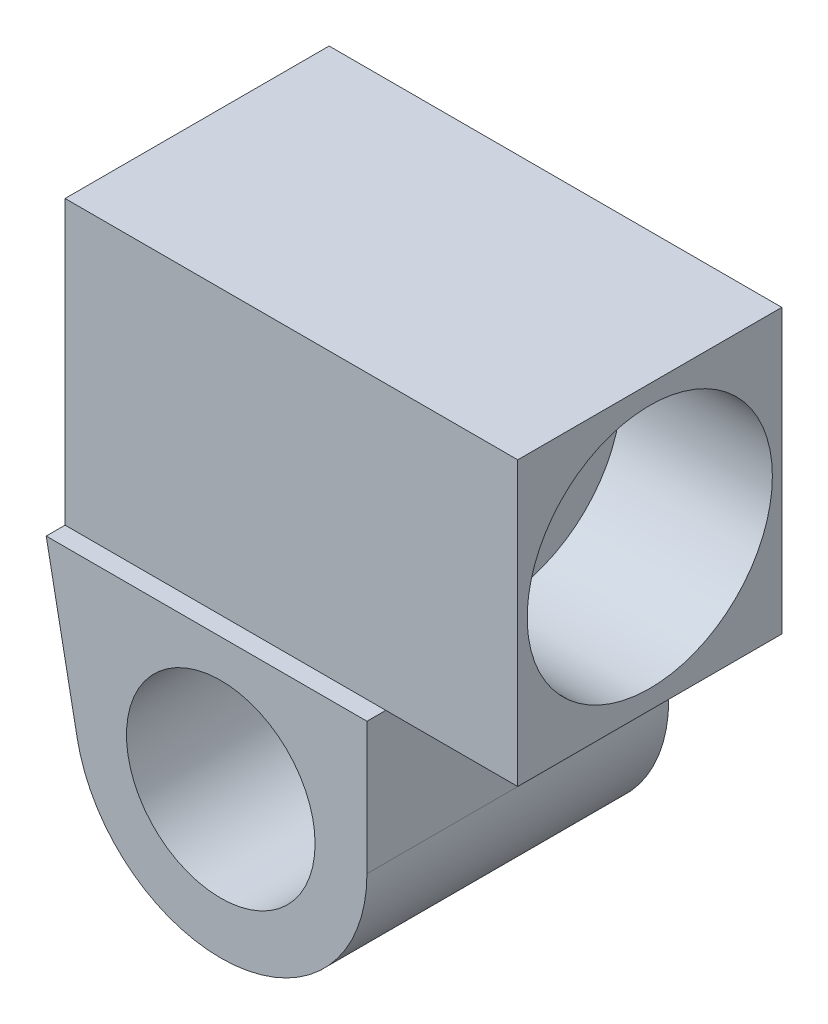
from build123d import *

# Parameters (mm, degrees)
STOCK_4_1_START       = -70
STOCK_4_1_OUTLINE_R   = 50
STOCK_4_1_DEPTH       = 140
STOCK_4_1_START_2     = -80
STOCK_4_1_2_OUTLINE_R = 50
STOCK_4_1_2_DEPTH     = 160
SKETCH1_R             = 65
CUT_EXTRUDE1_DEPTH    = 80


# Read off the part's stored shape, not the designer's step: Stock-4-1
with BuildPart() as part:
    # Stock-4-1 outline → Stock-4-1 (new body)
    with BuildSketch(Plane.XY.offset(STOCK_4_1_START)):
        with BuildLine():
            Line((170.057165499, -75), (240, -75))
            Line((240, -75), (240, 75))
            Line((240, 75), (0, 75))
            Line((0, 75), (0, -75))
            Line((0, -75), (16.481058781, -159.787697142))
            ThreePointArc((16.481058781, -159.787697142), (99.985211319, -222.143205373), (170.057165499, -145))
            Line((170.057165499, -145), (170.057165499, -75))
        make_face()
        with Locations((92.557165499, -145)):
            Circle(STOCK_4_1_OUTLINE_R, mode=Mode.SUBTRACT)
    extrude(amount=STOCK_4_1_DEPTH)

    # Stock-4-1 2 outline → Stock-4-1 2 (add)
    with BuildSketch(Plane.XY.offset(STOCK_4_1_START_2)):
        with BuildLine():
            Line((170.057165499, -145), (170.057165499, -75))
            Line((170.057165499, -75), (0, -75))
            Line((0, -75), (16.481058781, -159.787697142))
            ThreePointArc((16.481058781, -159.787697142), (99.985211319, -222.143205373), (170.057165499, -145))
        make_face()
        with Locations((92.557165499, -145)):
            Circle(STOCK_4_1_2_OUTLINE_R, mode=Mode.SUBTRACT)
    extrude(amount=STOCK_4_1_2_DEPTH)

    # Sketch1 → Cut-Extrude1 (cut)
    with BuildSketch(Plane(origin=(240, 0, 0), x_dir=(0, 0, -1), z_dir=(1, 0, 0))):
        Circle(SKETCH1_R)
    extrude(amount=-CUT_EXTRUDE1_DEPTH, mode=Mode.SUBTRACT)


solid = part.part
